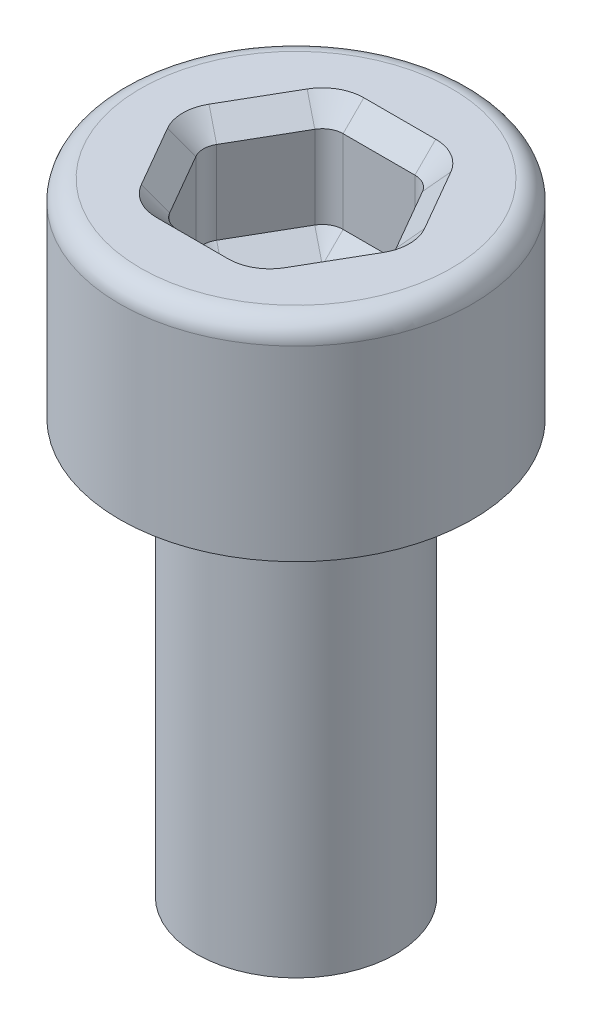
from build123d import *

# Parameters (mm, degrees)
SKETCH1_R           = 2.4
BOSS_EXTRUDE1_DEPTH = 10
SKETCH2_R           = 4.25
BOSS_EXTRUDE2_DEPTH = 5
CUT_EXTRUDE1_DEPTH  = 3
CHAMFER1_SIZE       = 0.5
FILLET1_R           = 0.5


with BuildPart() as part:
    # Sketch1 → Boss-Extrude1 (new body)
    with BuildSketch(Plane(origin=(0, 0, 0), x_dir=(1, 0, 0), z_dir=(0, 1, 0))):
        with Locations(Location((0, 0, 0), (0, 0, 270))):
            Circle(SKETCH1_R)
    extrude(amount=BOSS_EXTRUDE1_DEPTH)

    # Sketch2 → Boss-Extrude2 (add)
    with BuildSketch(Plane(origin=(0, 10, 0), x_dir=(1, 0, 0), z_dir=(0, 1, 0))):
        with Locations(Location((0, 0, 0), (0, 0, 270))):
            Circle(SKETCH2_R)
    extrude(amount=BOSS_EXTRUDE2_DEPTH)

    # Sketch3 → Cut-Extrude1 (cut)
    with BuildSketch(Plane(origin=(0, 15, 0), x_dir=(1, 0, 0), z_dir=(0, 1, 0))):
        with BuildLine():
            Line((2.165063509, 0.25), (1.299038106, 1.75))
            ThreePointArc((1.299038106, 1.75), (1.116025404, 1.933012702), (0.866025404, 2))
            Line((0.866025404, 2), (-0.866025404, 2))
            ThreePointArc((-0.866025404, 2), (-1.116025404, 1.933012702), (-1.299038106, 1.75))
            Line((-1.299038106, 1.75), (-2.165063509, 0.25))
            ThreePointArc((-2.165063509, 0.25), (-2.232050808, 0), (-2.165063509, -0.25))
            Line((-2.165063509, -0.25), (-1.299038106, -1.75))
            ThreePointArc((-1.299038106, -1.75), (-1.116025404, -1.933012702), (-0.866025404, -2))
            Line((-0.866025404, -2), (0.866025404, -2))
            ThreePointArc((0.866025404, -2), (1.116025404, -1.933012702), (1.299038106, -1.75))
            Line((1.299038106, -1.75), (2.165063509, -0.25))
            ThreePointArc((2.165063509, -0.25), (2.232050808, 0), (2.165063509, 0.25))
        make_face()
    extrude(amount=-CUT_EXTRUDE1_DEPTH, mode=Mode.SUBTRACT)

    # Chamfer1
    chamfer1_edges = [part.edges().sort_by_distance(p)[0] for p in [
        (-2.232050808, 12, 0),
        (-1.732050808, 12, -1),
        (-1.116025404, 12, -1.933012702),
        (0, 12, -2),
        (1.116025404, 12, -1.933012702),
        (1.732050808, 12, -1),
        (2.232050808, 12, 0),
        (1.732050808, 12, 1),
        (1.116025404, 12, 1.933012702),
        (0, 12, 2),
        (-1.116025404, 12, 1.933012702),
        (-1.732050808, 12, 1),
        (-2.232050808, 15, 0),
        (-1.732050808, 15, 1),
        (-1.116025404, 15, 1.933012702),
        (0, 15, 2),
        (1.116025404, 15, 1.933012702),
        (1.732050808, 15, 1),
        (2.232050808, 15, 0),
        (1.732050808, 15, -1),
        (1.116025404, 15, -1.933012702),
        (0, 15, -2),
        (-1.116025404, 15, -1.933012702),
        (-1.732050808, 15, -1),
    ]]
    chamfer(chamfer1_edges, length=CHAMFER1_SIZE - 0.0001)  # a hair under: the kernel refuses the full size

    # Fillet1
    fillet1_edges = [part.edges().sort_by_distance(p)[0] for p in [
        (0, 15, -4.25),
    ]]
    fillet(fillet1_edges, radius=FILLET1_R)


solid = part.part
